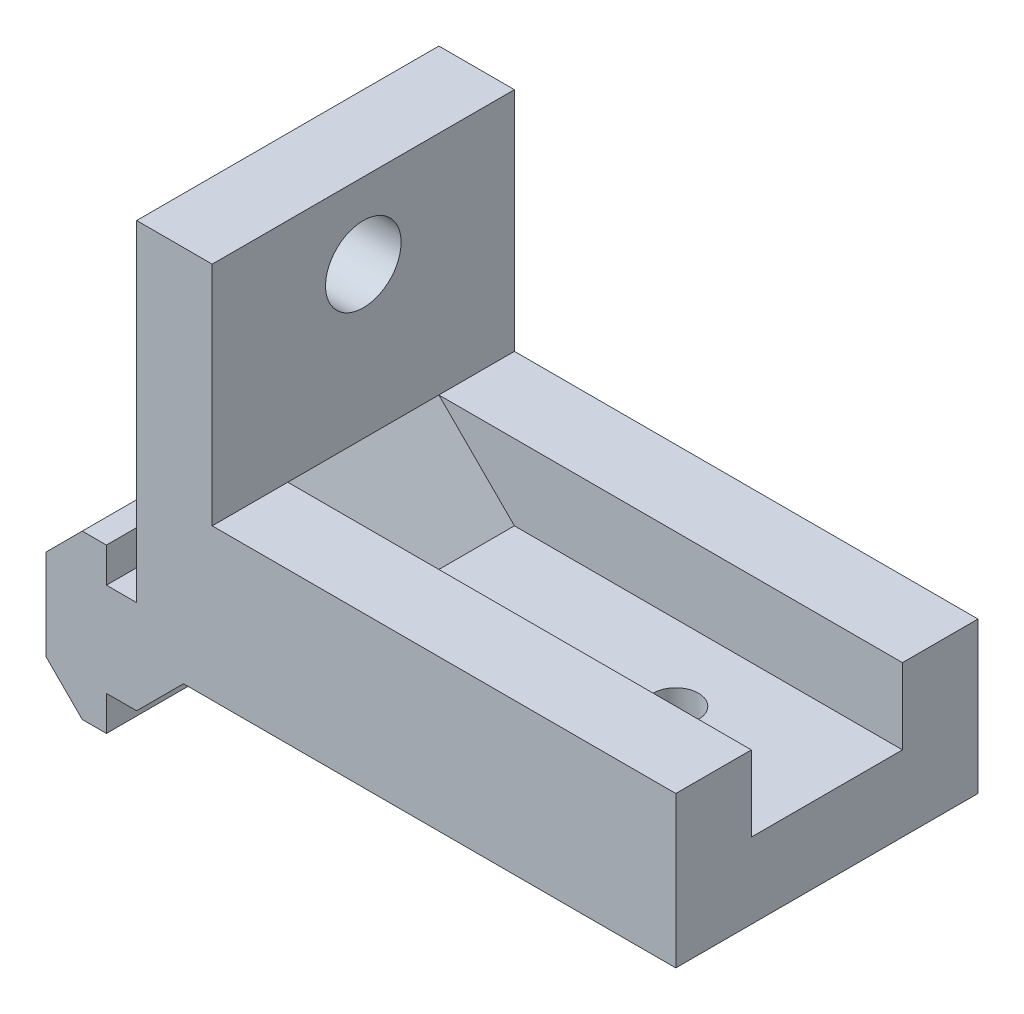
from build123d import *

# Parameters (mm, degrees)
SKETCH_1_W          = 35.68
SKETCH_1_H          = 20
SKETCH_1_R          = 1.5
EXTRUDE_1_DEPTH     = 5
EXTRUDE_2_DEPTH     = 10
SKETCH_1_5_R        = 1.5
CUT_EXTRUDE_1_DEPTH = 1.5
EXTRUDE_4_DEPTH     = 25
CUT_EXTRUDE_3_REACH = 46.7
SKETCH_3_R          = 2.5
EXTRUDE_START       = -10
EXTRUDE_3_DEPTH     = 20
CHAMFER_1_SIZE      = 3.1
CHAMFER_2_SIZE      = 5


with BuildPart() as part:
    # 草图1 → 凸台-拉伸1 (new body)
    with BuildSketch(Plane(origin=(0, 0, 0), x_dir=(1, 0, 0), z_dir=(0, 1, 0))):
        with Locations((17.84, 0)):
            Rectangle(SKETCH_1_W, SKETCH_1_H)
        with Locations(Location((25.68, 0, 0), (0, 0, 270))):
            Circle(SKETCH_1_R, mode=Mode.SUBTRACT)
    extrude(amount=EXTRUDE_1_DEPTH)

    # 草图1<4> → 凸台-拉伸2 (add)
    with BuildSketch(Plane(origin=(0, 0, 0), x_dir=(1, 0, 0), z_dir=(0, 1, 0))):
        Polygon((25.68, 5), (35.68, 5), (35.68, 10), (5, 10), (5, 5), align=None)
        Polygon((35.68, -10), (35.68, -5), (25.68, -5), (5, -5), (5, -10), align=None)
    extrude(amount=EXTRUDE_2_DEPTH)

    # 草图1<5> → 切除-拉伸1 (cut)
    with BuildSketch(Plane(origin=(0, 0, 0), x_dir=(1, 0, 0), z_dir=(0, 1, 0))):
        Polygon((24.09228676, -2.75), (27.26771324, -2.75), (28.855426481, 0), (27.26771324, 2.75), (24.09228676, 2.75), (22.504573519, 0), align=None)
        with Locations(Location((25.68, 0, 0), (0, 0, 270))):
            Circle(SKETCH_1_5_R, mode=Mode.SUBTRACT)
    extrude(amount=CUT_EXTRUDE_1_DEPTH, mode=Mode.SUBTRACT)

    # 草图1<6> → 凸台-拉伸4 (add)
    with BuildSketch(Plane(origin=(0, 0, 0), x_dir=(1, 0, 0), z_dir=(0, 1, 0))):
        Polygon((5, -5), (5, 5), (5, 10), (0, 10), (0, -10), (5, -10), align=None)
    extrude(amount=EXTRUDE_4_DEPTH)

    # 草图3 → 切除-拉伸3 (cut, up to next)
    with BuildSketch(Plane(origin=(0, 0, 0), x_dir=(0, 0, -1), z_dir=(1, 0, 0)), mode=Mode.PRIVATE) as cut_extrude_3_sk1:
        with Locations((0, 20)):
            Circle(SKETCH_3_R)
    cut_extrude_3_tool1 = extrude(cut_extrude_3_sk1.sketch, amount=CUT_EXTRUDE_3_REACH, mode=Mode.PRIVATE) & part.part
    add(cut_extrude_3_tool1.solids().sort_by_distance((0, 20, 0))[0], mode=Mode.SUBTRACT)

    # 草图2 → 凸台-拉伸3 (add)
    with BuildSketch(Plane.XY.offset(EXTRUDE_START)):
        Polygon((0, 3.1), (-2, 3.1), (-2, 5.4), (-3.6, 5.4), (-6, 3), (-6, -3), (-3.6, -5.4), (-2, -5.4), (-2, -3.1), (0, -3.1), align=None)
    extrude(amount=EXTRUDE_3_DEPTH)

    # 倒角1
    chamfer_1_edges = [part.edges().sort_by_distance(p)[0] for p in [
        (0, 0, 0),
    ]]
    chamfer(chamfer_1_edges, length=CHAMFER_1_SIZE - 0.0001)  # a hair under: the kernel refuses the full size

    # 倒角2
    chamfer_2_edges = [part.edges().sort_by_distance(p)[0] for p in [
        (5, 5, 0),
    ]]
    chamfer(chamfer_2_edges, length=CHAMFER_2_SIZE)


solid = part.part
